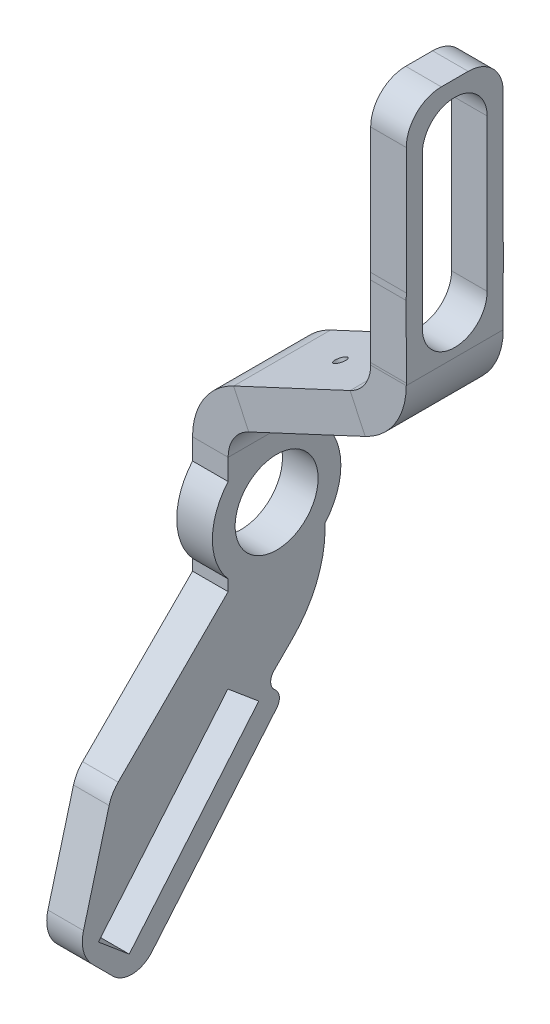
from build123d import *

# Parameters (mm, degrees)
BASE_FLANGE1_START     = -3.048
BASE_FLANGE1_OUTLINE_R = 3.55
BASE_FLANGE1_DEPTH     = 3.048
CHAMFER1_SIZE          = 5.5
CHAMFER1_SIZE2         = 9.526279442
FILLET5_R              = 3
JOG1_START             = -32.26085306
JOG1_DEPTH             = 22.133833772
JOG1_START_2           = -30.91085306
JOG1_2_DEPTH           = 1.375
JOG1_START_3           = -23.98585306
JOG1_3_DEPTH           = 1.375
JOG1_START_4           = -30.914437073
JOG1_4_DEPTH           = 8.307168025
JOG1_5_DEPTH           = 15.25
FILLET4_R              = 3
CUT_EXTRUDE3_DEPTH     = 78.680918765
BOSS_EXTRUDE1_DEPTH    = 3.048
CUT_EXTRUDE4_REACH     = 59.066
SKETCH15_R             = 0.5


with BuildPart() as part:
    # Base-Flange1: read off the stored shape, not the designer's step
    # Base-Flange1 outline → Base-Flange1 (new body)
    with BuildSketch(Plane(origin=(0, 0, 0), x_dir=(0, 0, -1), z_dir=(1, 0, 0)).offset(BASE_FLANGE1_START)):
        with BuildLine():
            Line((11.76085306, 2.855261469), (28.086146356, 19.180554765))
            ThreePointArc((28.086146356, 19.180554765), (30.176735706, 22.309342834), (30.91085306, 26))
            Line((30.91085306, 26), (30.91085306, 26.390637175))
            ThreePointArc((30.91085306, 26.390637175), (32.26085306, 30), (30.91085306, 33.609362825))
            Line((30.91085306, 33.609362825), (30.91085306, 48.531723164))
            Line((30.91085306, 48.531723164), (30.914437073, 54.658476217))
            Line((30.914437073, 54.658476217), (30.91085306, 55.218276836))
            Line((30.91085306, 55.218276836), (30.91085306, 69))
            Line((30.91085306, 69), (22.61085306, 69))
            Line((22.61085306, 69), (22.61085306, 55.218276836))
            Line((22.61085306, 55.218276836), (22.607269048, 54.658476217))
            Line((22.607269048, 54.658476217), (22.61085306, 48.531723164))
            Line((22.61085306, 48.531723164), (22.61085306, 33.609362825))
            ThreePointArc((22.61085306, 33.609362825), (21.26085306, 30), (22.61085306, 26.390637175))
            Line((22.61085306, 26.390637175), (22.61085306, 25.443234037))
            Line((22.61085306, 25.443234037), (5.891866776, 8.724247753))
            Line((5.891866776, 8.724247753), (11.76085306, 2.855261469))
        make_face()
        with Locations((26.76085306, 30)):
            Circle(BASE_FLANGE1_OUTLINE_R, mode=Mode.SUBTRACT)
        with BuildLine():
            ThreePointArc((23.98585306, 64.875), (26.76085306, 67.65), (29.53585306, 64.875))
            Line((29.53585306, 64.875), (29.53585306, 51.875))
            ThreePointArc((29.53585306, 51.875), (26.76085306, 49.1), (23.98585306, 51.875))
            Line((23.98585306, 51.875), (23.98585306, 64.875))
        make_face(mode=Mode.SUBTRACT)
    extrude(amount=BASE_FLANGE1_DEPTH)

    # Chamfer1
    chamfer1_edges = [part.edges().sort_by_distance(p)[0] for p in [
        (-1.524, 8.724247753, -5.891866776),
    ]]
    chamfer1_side = [part.faces().sort_by_distance(p)[0] for p in [
        (-1.524, 5.789754611, -8.826359918),
    ]]
    chamfer(chamfer1_edges, length=CHAMFER1_SIZE, length2=CHAMFER1_SIZE2, reference=chamfer1_side[0])

    # Fillet5
    fillet5_edges = [part.edges().sort_by_distance(p)[0] for p in [
        (-1.524, 15.460344546, -12.627963569),
        (-1.524, 4.835160456, -9.780954073),
    ]]
    fillet(fillet5_edges, radius=FILLET5_R)

    # Jog1: read off the stored shape, not the designer's step
    # Jog1 outline → Jog1 (cut)
    with BuildSketch(Plane.XY.offset(JOG1_START)):
        with BuildLine():
            ThreePointArc((-3.048, 35.406615264), (-2.231290862, 38.454615264), (0, 40.685906126))
            Line((0, 40.685906126), (0, 69))
            Line((0, 69), (-3.048, 69))
            Line((-3.048, 69), (-3.048, 35.406615264))
        make_face()
    extrude(amount=JOG1_DEPTH, mode=Mode.SUBTRACT)

    # Jog1 2 outline → Jog1 2 (add)
    with BuildSketch(Plane.XY.offset(JOG1_START_2)):
        with BuildLine():
            ThreePointArc((0, 35.406615264), (0.477342873, 37.04430447), (1.759859538, 38.169041399))
            Line((1.759859538, 38.169041399), (11.730280924, 42.818325246))
            ThreePointArc((11.730280924, 42.818325246), (14.295314254, 45.067799104), (15.25, 48.343177516))
            Line((15.25, 48.343177516), (15.25, 69))
            Line((15.25, 69), (12.202, 69))
            Line((12.202, 69), (12.202, 48.343177516))
            ThreePointArc((12.202, 48.343177516), (11.724657127, 46.70548831), (10.442140462, 45.580751381))
            Line((10.442140462, 45.580751381), (0.471719076, 40.931467534))
            ThreePointArc((0.471719076, 40.931467534), (0.233180454, 40.813833303), (0, 40.685906126))
            Line((0, 40.685906126), (0, 35.406615264))
        make_face()
    extrude(amount=JOG1_2_DEPTH)

    # Jog1 3 outline → Jog1 3 (add)
    with BuildSketch(Plane.XY.offset(JOG1_START_3)):
        with BuildLine():
            ThreePointArc((0, 35.406615264), (0.477342873, 37.04430447), (1.759859538, 38.169041399))
            Line((1.759859538, 38.169041399), (11.730280924, 42.818325246))
            ThreePointArc((11.730280924, 42.818325246), (14.295314254, 45.067799104), (15.25, 48.343177516))
            Line((15.25, 48.343177516), (15.25, 69))
            Line((15.25, 69), (12.202, 69))
            Line((12.202, 69), (12.202, 48.343177516))
            ThreePointArc((12.202, 48.343177516), (11.724657127, 46.70548831), (10.442140462, 45.580751381))
            Line((10.442140462, 45.580751381), (0.471719076, 40.931467534))
            ThreePointArc((0.471719076, 40.931467534), (0.233180454, 40.813833303), (0, 40.685906126))
            Line((0, 40.685906126), (0, 35.406615264))
        make_face()
    extrude(amount=JOG1_3_DEPTH)

    # Jog1 4 outline → Jog1 4 (add)
    with BuildSketch(Plane.XY.offset(JOG1_START_4)):
        with BuildLine():
            ThreePointArc((0, 35.406615264), (0.477342873, 37.04430447), (1.759859538, 38.169041399))
            Line((1.759859538, 38.169041399), (11.730280924, 42.818325246))
            ThreePointArc((11.730280924, 42.818325246), (14.295314254, 45.067799104), (15.25, 48.343177516))
            Line((15.25, 48.343177516), (15.25, 69))
            Line((15.25, 69), (12.202, 69))
            Line((12.202, 69), (12.202, 48.343177516))
            ThreePointArc((12.202, 48.343177516), (11.724657127, 46.70548831), (10.442140462, 45.580751381))
            Line((10.442140462, 45.580751381), (0.471719076, 40.931467534))
            ThreePointArc((0.471719076, 40.931467534), (0.233180454, 40.813833303), (0, 40.685906126))
            Line((0, 40.685906126), (0, 35.406615264))
        make_face()
    extrude(amount=JOG1_4_DEPTH)

    # Jog1 5 outline → Jog1 5 (cut)
    with BuildSketch(Plane.YZ):
        Polygon((48.531723164, -30.91085306), (34, -30.91085306), (34, -30.914437073), (54.658476217, -30.914437073), align=None)
        Polygon((34, -22.607269048), (34, -22.61085306), (48.531723164, -22.61085306), (54.658476217, -22.607269048), align=None)
        Polygon((55.218276836, -30.91085306), (54.658476217, -30.914437073), (70, -30.914437073), (70, -30.91085306), align=None)
        Polygon((70, -22.607269048), (54.658476217, -22.607269048), (55.218276836, -22.61085306), (70, -22.61085306), align=None)
        with BuildLine():
            Line((64.875, -23.98585306), (51.875, -23.98585306))
            ThreePointArc((51.875, -23.98585306), (49.1, -26.76085306), (51.875, -29.53585306))
            Line((51.875, -29.53585306), (64.875, -29.53585306))
            ThreePointArc((64.875, -29.53585306), (67.65, -26.76085306), (64.875, -23.98585306))
        make_face()
    extrude(amount=JOG1_5_DEPTH, mode=Mode.SUBTRACT)

    # Fillet4
    fillet4_edges = [part.edges().sort_by_distance(p)[0] for p in [
        (13.726, 69, -30.91085306),
        (13.726, 69, -22.61085306),
    ]]
    fillet(fillet4_edges, radius=FILLET4_R)

    # Sketch14<4> → Cut-Extrude3 (cut, through all)
    with BuildSketch(Plane(origin=(0, 0, 0), x_dir=(0, 0, -1), z_dir=(1, 0, 0))):
        Polygon((11.500086567, 5.024730268), (12.821513232, 3.915921641), (25.065698027, 16.160106436), (22.588172835, 18.238996911), align=None)
        Polygon((25.065698027, 16.160106436), (12.821513232, 3.915921641), (14.142939896, 2.807113014), (25.231026163, 16.021379658), align=None)
    extrude(amount=-CUT_EXTRUDE3_DEPTH, mode=Mode.SUBTRACT)

    # Sketch14 → Boss-Extrude1 (add)
    with BuildSketch(Plane(origin=(0, 0, 0), x_dir=(0, 0, -1), z_dir=(1, 0, 0))):
        with BuildLine():
            Line((12.821513232, 3.915921641), (11.76085306, 2.855261469))
            Line((11.76085306, 2.855261469), (12.761421716, 1.854692814))
            ThreePointArc((12.761421716, 1.854692814), (14.450555595, 1.197824573), (16.07601197, 1.999410949))
            Line((16.07601197, 1.999410949), (26.76311505, 14.735804439))
            ThreePointArc((26.76311505, 14.735804439), (26.992415169, 15.474972553), (26.625555608, 16.156413752))
            ThreePointArc((26.625555608, 16.156413752), (26.255439336, 16.881363004), (26.546933828, 17.641342237))
            Line((26.546933828, 17.641342237), (25.065698027, 16.160106436))
            Line((25.065698027, 16.160106436), (25.231026163, 16.021379658))
            Line((25.231026163, 16.021379658), (14.142939896, 2.807113014))
            Line((14.142939896, 2.807113014), (12.821513232, 3.915921641))
        make_face()
    extrude(amount=-BOSS_EXTRUDE1_DEPTH)

    # Sketch15 → Cut-Extrude4 (cut, up to next)
    with BuildSketch(Plane(origin=(-15.593409677, 33.440174967, 0), x_dir=(0.906307787036651, 0.4226182617406973, 0), z_dir=(-0.4226182617406973, 0.906307787036651, 0)), mode=Mode.PRIVATE) as cut_extrude4_sk1:
        with Locations(Location((23.226479732, 26.76085306, 0), (0, 0, 180))):
            Circle(SKETCH15_R)
    cut_extrude4_tool1 = extrude(cut_extrude4_sk1.sketch, amount=-CUT_EXTRUDE4_REACH, mode=Mode.PRIVATE) & part.part
    add(cut_extrude4_tool1.solids().sort_by_distance((5.45693, 43.256109, -26.760853))[0], mode=Mode.SUBTRACT)


solid = part.part
